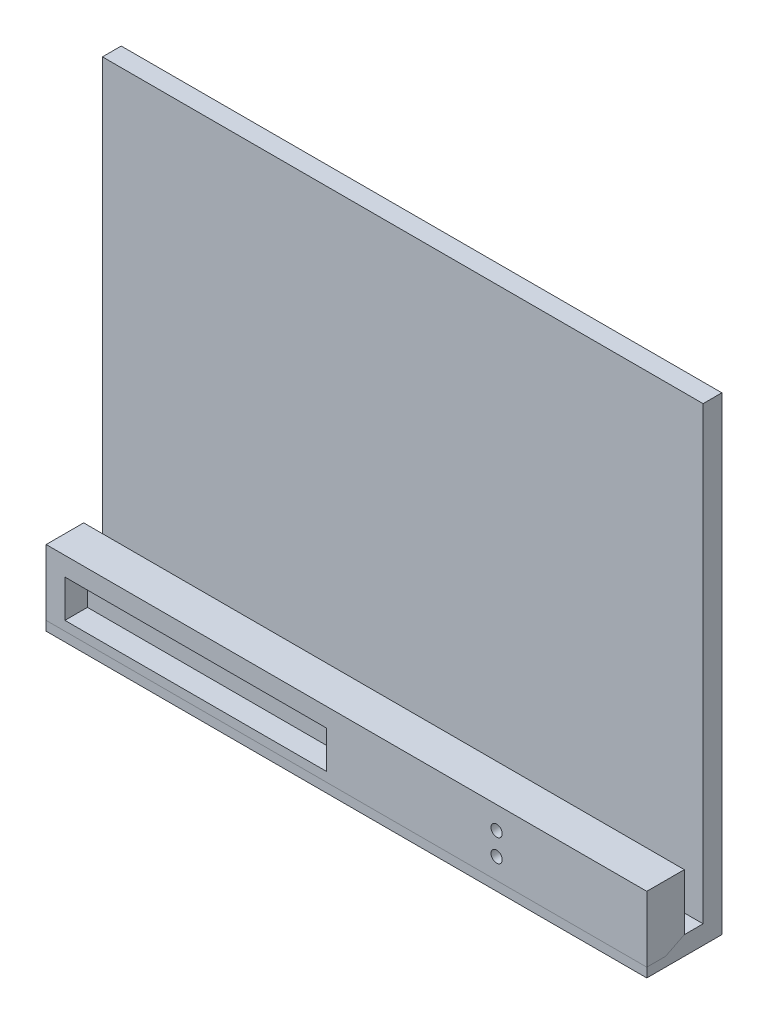
from build123d import *

# Parameters (mm, degrees)
SKETCH1_W              = 203.2
SKETCH1_H              = 158.75
BOSS_EXTRUDE1_DEPTH    = 6.35
SKETCH2_W              = 203.2
SKETCH2_H              = 6.35
BOSS_EXTRUDE2_DEPTH    = 19.05
SKETCH3_W              = 203.2
SKETCH3_H              = 12.7
BOSS_EXTRUDE3_DEPTH    = 19.05
SKETCH4_W              = 88.555771164
SKETCH4_H              = 12.7
CUT_EXTRUDE1_DEPTH     = 7.62
CUT_EXTRUDE2_REACH     = 261.108
SKETCH5_R              = 1.905
SPLIT1_SURFACE_1_BACK  = 260.108
SPLIT1_SURFACE_1_DEPTH = 520.216
SPLIT1_SURFACE_2_BACK  = 260.108
SPLIT1_SURFACE_2_DEPTH = 520.216


with BuildPart() as part:
    # Sketch1 → Boss-Extrude1 (new body)
    with BuildSketch(Plane.XY):
        with Locations((101.6, 79.375)):
            Rectangle(SKETCH1_W, SKETCH1_H)
    extrude(amount=BOSS_EXTRUDE1_DEPTH)

    # Sketch2 → Boss-Extrude2 (add)
    with BuildSketch(Plane.XY.offset(6.35)):
        with Locations((101.6, 3.175)):
            Rectangle(SKETCH2_W, SKETCH2_H)
    extrude(amount=BOSS_EXTRUDE2_DEPTH)

    # Sketch3 → Boss-Extrude3 (add)
    with BuildSketch(Plane(origin=(0, 6.35, 0), x_dir=(1, 0, 0), z_dir=(0, 1, 0))):
        with Locations((101.6, -19.05)):
            Rectangle(SKETCH3_W, SKETCH3_H)
    extrude(amount=BOSS_EXTRUDE3_DEPTH)

    # Sketch4 → Cut-Extrude1 (cut)
    with BuildSketch(Plane.XY.offset(25.4)):
        with Locations((50.627885582, 12.7)):
            Rectangle(SKETCH4_W, SKETCH4_H)
    extrude(amount=-CUT_EXTRUDE1_DEPTH, mode=Mode.SUBTRACT)

    # Sketch5 → Cut-Extrude2 (cut, up to next)
    with BuildSketch(Plane.XY.offset(25.4), mode=Mode.PRIVATE) as cut_extrude2_sk1:
        with Locations((152.4, 17.78)):
            Circle(SKETCH5_R)
    cut_extrude2_tool1 = extrude(cut_extrude2_sk1.sketch, amount=-CUT_EXTRUDE2_REACH, mode=Mode.PRIVATE) & part.part
    # Sketch5 → Cut-Extrude2 (cut, up to next)
    with BuildSketch(Plane.XY.offset(25.4), mode=Mode.PRIVATE) as cut_extrude2_sk2:
        with Locations((152.4, 10.16)):
            Circle(SKETCH5_R)
    cut_extrude2_tool2 = extrude(cut_extrude2_sk2.sketch, amount=-CUT_EXTRUDE2_REACH, mode=Mode.PRIVATE) & part.part
    add(cut_extrude2_tool1.solids().sort_by_distance((152.4, 17.78, 25.4))[0], mode=Mode.SUBTRACT)
    add(cut_extrude2_tool2.solids().sort_by_distance((152.4, 10.16, 25.4))[0], mode=Mode.SUBTRACT)


with BuildPart() as body_2:
    # Split1: the piece behind the surface
    add(part.part)
    # Split1 surface: a surface, the sketch's curves swept straight by 520.216 mm
    with BuildLine(Plane(origin=(203.2, 0, 0), x_dir=(0, 0, -1), z_dir=(1, 0, 0)).offset(-SPLIT1_SURFACE_1_BACK), mode=Mode.PRIVATE) as split1_surface_1_path:
        Line((-25.4, 3.175), (-19.05, 3.175))
        Line((-19.05, 3.175), (-12.7, 6.35))
    split1_surface_1 = Shell.extrude(split1_surface_1_path.wire(), (1 * SPLIT1_SURFACE_1_DEPTH, 0 * SPLIT1_SURFACE_1_DEPTH, 0 * SPLIT1_SURFACE_1_DEPTH))
    split(bisect_by=split1_surface_1, keep=Keep.BOTTOM)


with BuildPart() as part_1:
    add(part.part)

    # Split1: split by a surface, the side it looks to stays
    # Split1 surface: a surface, the sketch's curves swept straight by 520.216 mm
    with BuildLine(Plane(origin=(203.2, 0, 0), x_dir=(0, 0, -1), z_dir=(1, 0, 0)).offset(-SPLIT1_SURFACE_2_BACK), mode=Mode.PRIVATE) as split1_surface_2_path:
        Line((-25.4, 3.175), (-19.05, 3.175))
        Line((-19.05, 3.175), (-12.7, 6.35))
    split1_surface_2 = Shell.extrude(split1_surface_2_path.wire(), (1 * SPLIT1_SURFACE_2_DEPTH, 0 * SPLIT1_SURFACE_2_DEPTH, 0 * SPLIT1_SURFACE_2_DEPTH))
    split(bisect_by=split1_surface_2, keep=Keep.TOP)


solid = Compound([body_2.part, part_1.part])
